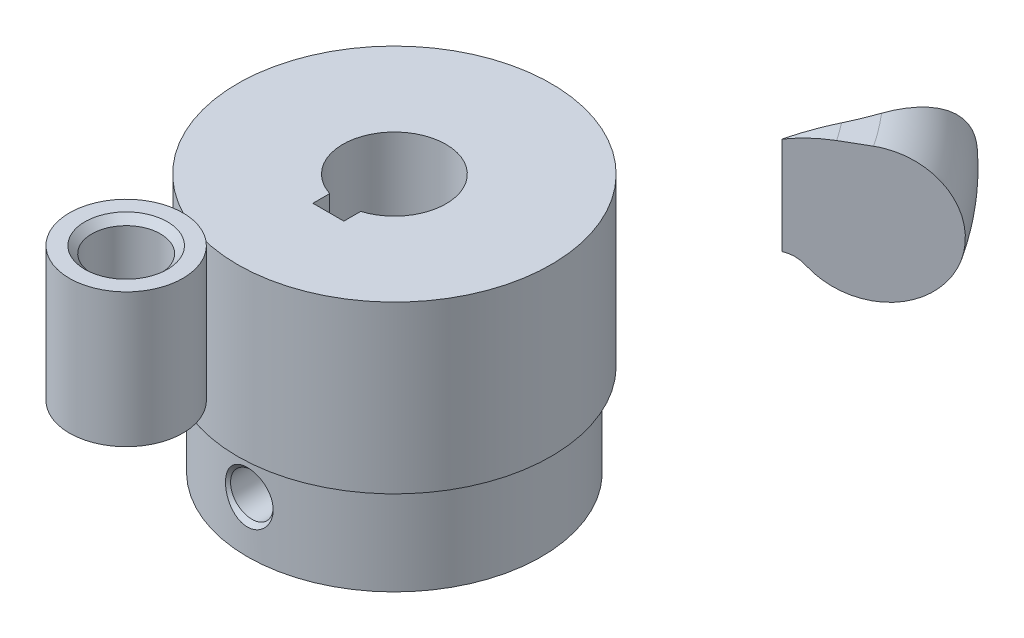
from build123d import *

# Parameters (mm, degrees)
CUT_EXTRUDE_1_DEPTH    = 32
PATTERN_START          = 2
PATTERN_LINEAR_1_DEPTH = 30
SKETCH_5_W             = 5.5
SKETCH_5_H             = 13
CUT_EXTRUDE_2_DEPTH    = 25


# Read off the part's stored shape, not the designer's step: 阵列(线性)1
with BuildPart() as part:
    # 草图1 → 旋转1 (revolve)
    with BuildSketch(Plane.XY, mode=Mode.PRIVATE) as revolve_1_sk:
        with BuildLine():
            Line((0, 20), (5, 20))
            Line((5, 20), (5, 16.939442451))
            Line((5, 16.939442451), (23.498601429, 29.700772791))
            ThreePointArc((23.498601429, 29.700772791), (27.014696752, 31.411890394), (30.880570115, 32))
            Line((30.880570115, 32), (33.5, 32))
            ThreePointArc((33.5, 32), (39.438608051, 22.857475748), (28.671410524, 21.148595207))
            ThreePointArc((28.671410524, 21.148595207), (27.10540909, 21.957966627), (25.394651363, 21.5328189))
            Line((25.394651363, 21.5328189), (5, 7.463491323))
            Line((5, 7.463491323), (5, 2))
            Line((5, 2), (0, 2))
            Line((0, 2), (0, 20))
        make_face()
    revolve(revolve_1_sk.sketch.rotate(Axis((0, 0, 0), (0, 1, 0)), 270), axis=Axis((0, 0, 0), (0, 1, 0)))

    # 草图2 → 切除-拉伸1 (cut)
    with BuildSketch(Plane(origin=(0, 0, 0), x_dir=(1, 0, 0), z_dir=(0, 1, 0))):
        with BuildLine():
            Line((26.001324465, 7.275378072), (10.010517998, -1.956918346))
            ThreePointArc((10.010517998, -1.956918346), (8.833459119, -5.1), (6.7, -7.690903718))
            Line((6.7, -7.690903718), (6.7, -26.155496554))
            ThreePointArc((6.7, -26.155496554), (23.382685902, -13.5), (26.001324465, 7.275378072))
        make_face()
    extrude(amount=CUT_EXTRUDE_1_DEPTH, mode=Mode.SUBTRACT)

    # 阵列(线性)1 outline → 阵列(线性)1 (cut)
    with BuildSketch(Plane(origin=(0, 0, 0), x_dir=(1, 0, 0), z_dir=(0, 1, 0)).offset(PATTERN_START)):
        with BuildLine():
            Line((33.524972429, 21.819158249), (22.255200364, 15.312552314))
            ThreePointArc((22.255200364, 15.312552314), (25.62325476, 22.088313006), (26.978891649, 29.532570659))
            Line((26.978891649, 29.532570659), (27.472169879, 42))
            Line((27.472169879, 42), (-42, 42))
            Line((-42, 42), (-42, -42))
            Line((-42, -42), (42, -42))
            Line((42, -42), (42, 26.712217698))
            Line((42, 26.712217698), (33.524972429, 21.819158249))
        make_face()
        with BuildLine():
            Line((10.010517998, -1.956918346), (26.001324465, 7.275378072))
            ThreePointArc((26.001324465, 7.275378072), (23.382685902, -13.5), (6.7, -26.155496554))
            Line((6.7, -26.155496554), (6.7, -7.690903718))
            ThreePointArc((6.7, -7.690903718), (8.833459119, -5.1), (10.010517998, -1.956918346))
        make_face(mode=Mode.SUBTRACT)
    extrude(amount=PATTERN_LINEAR_1_DEPTH, mode=Mode.SUBTRACT)


with BuildPart() as body_2:
    # 草图4 → 旋转2 (revolve)
    with BuildSketch(Plane.XY, mode=Mode.PRIVATE) as revolve_2_sk:
        Polygon((0, 25), (15.2, 25), (15.2, 8.9), (14.25, 8.9), (14.25, 0), (0, 0), align=None)
    revolve(revolve_2_sk.sketch.rotate(Axis((0, 0, 0), (0, 1, 0)), 270), axis=Axis((0, 0, 0), (0, 1, 0)))

    # 草图7 → 切除-拉伸2 (cut)
    with BuildSketch(Plane(origin=(0, 0, 0), x_dir=(1, 0, 0), z_dir=(0, 1, 0))):
        with BuildLine():
            Line((-1.5, -4.769696007), (-1.5, -6.4))
            Line((-1.5, -6.4), (1.5, -6.4))
            Line((1.5, -6.4), (1.5, -4.769696007))
            ThreePointArc((1.5, -4.769696007), (0, 5), (-1.5, -4.769696007))
        make_face()
    extrude(amount=CUT_EXTRUDE_2_DEPTH, mode=Mode.SUBTRACT)

    # 草图8 → 切除-旋转2 (revolve, cut)
    with BuildSketch(Plane(origin=(0, 0, 0), x_dir=(0, 0, -1), z_dir=(1, 0, 0)), mode=Mode.PRIVATE) as cut_revolve_2_sk:
        Polygon((-14.25, 5), (-14.25, 7.5), (-13.817, 7.067), (-4.5, 7.067), (-4.5, 5), align=None)
    revolve(cut_revolve_2_sk.sketch.rotate(Axis((0, 5, 4.5), (0, 0, 1)), 270), axis=Axis((0, 5, 4.5), (0, 0, 1)), mode=Mode.SUBTRACT)


with BuildPart() as body_3:
    # 草图5 → 旋转3 (revolve)
    with BuildSketch(Plane(origin=(0, 0, 0), x_dir=(0, 0, -1), z_dir=(1, 0, 0)), mode=Mode.PRIVATE) as revolve_3_sk:
        with Locations((-23.25, 25.5)):
            Rectangle(SKETCH_5_W, SKETCH_5_H)
    revolve(revolve_3_sk.sketch.rotate(Axis((0, 19, 26), (0, 1, 0)), 180), axis=Axis((0, 19, 26), (0, 1, 0)))

    # 草图6 → 切除-旋转1 (revolve, cut)
    with BuildSketch(Plane(origin=(0, 0, 0), x_dir=(0, 0, -1), z_dir=(1, 0, 0)), mode=Mode.PRIVATE) as cut_revolve_1_sk:
        Polygon((-26, 32), (-22, 32), (-22.6765, 31.3235), (-22.6765, 19.6765), (-22, 19), (-26, 19), align=None)
    revolve(cut_revolve_1_sk.sketch.rotate(Axis((0, 19, 26), (0, 1, 0)), 180), axis=Axis((0, 19, 26), (0, 1, 0)), mode=Mode.SUBTRACT)


solid = Compound([part.part, body_2.part, body_3.part])
